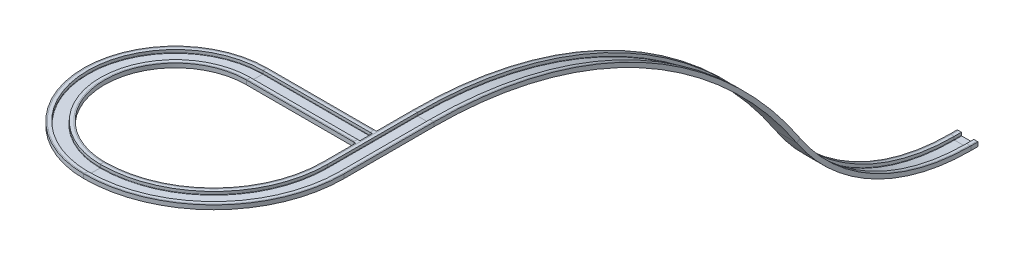
from build123d import *

# Parameters (mm, degrees)
FILLET3_R      = 15
FILLET4_R      = 15
SWEEP3_START   = 13897.441767453
SWEEP3_DEPTH   = 200
SWEEP3_2_DEPTH = 50
SWEEP3_START_2 = -5776.350160621
SWEEP3_3_DEPTH = 5476.350160621
SWEEP3_4_ANGLE = 180
SWEEP3_5_ANGLE = 90


with BuildPart() as part:
    # Sweep1: sweep along a path in Sketch3
    with BuildLine(Plane(origin=(0, 0, 0), x_dir=(0, 0, -1), z_dir=(1, 0, 0))) as sweep1_path:
        Line((0, 0), (-347.839296309, 0))
        ThreePointArc((-347.839296309, 0), (-5090.820828897, 1196.357220927), (-8698.942320439, 4499.174763695))
        ThreePointArc((-8698.942320439, 4499.174763695), (-16275.997452676, 11435.091603507), (-26236.258671111, 13947.441767453))
        Line((-26236.258671111, 13947.441767453), (-30575.705984425, 13947.441767453))
    # Sketch1 → Sweep1 (sweep)
    with BuildSketch(Plane.XY):
        Polygon((-300, 0), (300, 0), (300, 150), (450, 150), (500, 150), (500, -50), (-500, -50), (-500, 150), (-450, 150), (-300, 150), align=None)
    sweep(path=sweep1_path.line)

    # Fillet3
    fillet3_edges = [part.edges().sort_by_distance(p)[0] for p in [
        (300, 1196.357220927, 5090.820828897),
        (300, 11435.091603507, 16275.997452676),
        (300, 13947.441767453, 28405.982327768),
        (300, 0, 173.919648155),
    ]]
    fillet(fillet3_edges, radius=FILLET3_R)

    # Fillet4
    fillet4_edges = [part.edges().sort_by_distance(p)[0] for p in [
        (-300, 11435.091603507, 16275.997452676),
        (-300, 13947.441767453, 28405.982327768),
        (-300, 0, 173.919648155),
        (-300, 1196.357220927, 5090.820828897),
    ]]
    fillet(fillet4_edges, radius=FILLET4_R)

    # Sweep3: read off the stored shape, not the designer's step
    # Sweep3 outline → Sweep3 (add)
    with BuildSketch(Plane(origin=(0, 0, 0), x_dir=(1, 0, 0), z_dir=(0, 1, 0)).offset(SWEEP3_START)):
        with BuildLine():
            Line((-5776.350160621, -28210.325241689), (-500, -28210.325241689))
            Line((-500, -28210.325241689), (-500, -28010.325241689))
            Line((-500, -28010.325241689), (-5776.350160621, -28010.325241689))
            ThreePointArc((-5776.350160621, -28010.325241689), (-10197.2156123, -32431.190693367), (-5776.350160621, -36852.056145046))
            ThreePointArc((-5776.350160621, -36852.056145046), (-1338.300400944, -35013.755744102), (500, -30575.705984425))
            Line((500, -30575.705984425), (300, -30575.705984425))
            ThreePointArc((300, -30575.705984425), (-1479.721757182, -34872.334387864), (-5776.350160621, -36652.056145046))
            ThreePointArc((-5776.350160621, -36652.056145046), (-9997.2156123, -32431.190693367), (-5776.350160621, -28210.325241689))
        make_face()
        with BuildLine():
            Line((-500, -29010.325241689), (-500, -28810.325241689))
            Line((-500, -28810.325241689), (-5776.350160621, -28810.325241689))
            ThreePointArc((-5776.350160621, -28810.325241689), (-9397.2156123, -32431.190693367), (-5776.350160621, -36052.056145046))
            ThreePointArc((-5776.350160621, -36052.056145046), (-1903.985825894, -34448.070319152), (-300, -30575.705984425))
            Line((-300, -30575.705984425), (-500, -30575.705984425))
            ThreePointArc((-500, -30575.705984425), (-2045.407182131, -34306.648962915), (-5776.350160621, -35852.056145046))
            ThreePointArc((-5776.350160621, -35852.056145046), (-9197.2156123, -32431.190693367), (-5776.350160621, -29010.325241689))
            Line((-5776.350160621, -29010.325241689), (-500, -29010.325241689))
        make_face()
    extrude(amount=SWEEP3_DEPTH)

    # Sweep3 2 outline → Sweep3 2 (add)
    with BuildSketch(Plane(origin=(0, 0, 0), x_dir=(1, 0, 0), z_dir=(0, 1, 0)).offset(SWEEP3_START)):
        with BuildLine():
            Line((-500, -28810.325241689), (-500, -28210.325241689))
            Line((-500, -28210.325241689), (-5776.350160621, -28210.325241689))
            ThreePointArc((-5776.350160621, -28210.325241689), (-9997.2156123, -32431.190693367), (-5776.350160621, -36652.056145046))
            ThreePointArc((-5776.350160621, -36652.056145046), (-1479.721757182, -34872.334387864), (300, -30575.705984425))
            Line((300, -30575.705984425), (-300, -30575.705984425))
            ThreePointArc((-300, -30575.705984425), (-1903.985825894, -34448.070319152), (-5776.350160621, -36052.056145046))
            ThreePointArc((-5776.350160621, -36052.056145046), (-9397.2156123, -32431.190693367), (-5776.350160621, -28810.325241689))
            Line((-5776.350160621, -28810.325241689), (-500, -28810.325241689))
        make_face()
    extrude(amount=SWEEP3_2_DEPTH)

    # Sweep3 3 outline → Sweep3 3 (add)
    with BuildSketch(Plane.YZ.offset(SWEEP3_START_2)):
        with BuildLine():
            Line((13947.441767453, 28210.325241689), (13962.441767453, 28210.325241689))
            ThreePointArc((13962.441767453, 28210.325241689), (13951.835165735, 28214.718639971), (13947.441767453, 28225.325241689))
            Line((13947.441767453, 28225.325241689), (13947.441767453, 28210.325241689))
        make_face()
        with BuildLine():
            Line((13947.441767453, 28810.325241689), (13947.441767453, 28795.325241689))
            ThreePointArc((13947.441767453, 28795.325241689), (13951.835165735, 28805.931843407), (13962.441767453, 28810.325241689))
            Line((13962.441767453, 28810.325241689), (13947.441767453, 28810.325241689))
        make_face()
    extrude(amount=SWEEP3_3_DEPTH)

    # Sweep3 4 outline → Sweep3 4 (revolve)
    with BuildSketch(Plane(origin=(-5776.350160621, 0, 32431.190693368), x_dir=(0, 0, -1), z_dir=(1, 0, 0))):
        with BuildLine():
            ThreePointArc((4220.865451679, 13962.441767453), (4216.472053397, 13951.835165735), (4205.865451679, 13947.441767453))
            Line((4205.865451679, 13947.441767453), (4220.865451679, 13947.441767453))
            Line((4220.865451679, 13947.441767453), (4220.865451679, 13962.441767453))
        make_face()
        with BuildLine():
            Line((3620.865451679, 13947.441767453), (3635.865451679, 13947.441767453))
            ThreePointArc((3635.865451679, 13947.441767453), (3625.258849961, 13951.835165735), (3620.865451679, 13962.441767453))
            Line((3620.865451679, 13962.441767453), (3620.865451679, 13947.441767453))
        make_face()
    revolve(axis=Axis((-5776.350160621, 0, 32431.190693368), (0, 1, 0)), revolution_arc=SWEEP3_4_ANGLE)

    # Sweep3 5 outline → Sweep3 5 (revolve)
    with BuildSketch(Plane(origin=(-5776.350160621, 0, 30575.705984425), x_dir=(0, 0, 1), z_dir=(-1, 0, 0))):
        with BuildLine():
            ThreePointArc((6076.350160621, 13962.441767453), (6071.956762339, 13951.835165735), (6061.350160621, 13947.441767453))
            Line((6061.350160621, 13947.441767453), (6076.350160621, 13947.441767453))
            Line((6076.350160621, 13947.441767453), (6076.350160621, 13962.441767453))
        make_face()
        with BuildLine():
            Line((5476.350160621, 13947.441767453), (5491.350160622, 13947.441767453))
            ThreePointArc((5491.350160622, 13947.441767453), (5480.743558904, 13951.835165735), (5476.350160621, 13962.441767453))
            Line((5476.350160621, 13962.441767453), (5476.350160621, 13947.441767453))
        make_face()
    revolve(axis=Axis((-5776.350160621, 0, 30575.705984425), (0, 1, 0)), revolution_arc=SWEEP3_5_ANGLE)


solid = part.part
